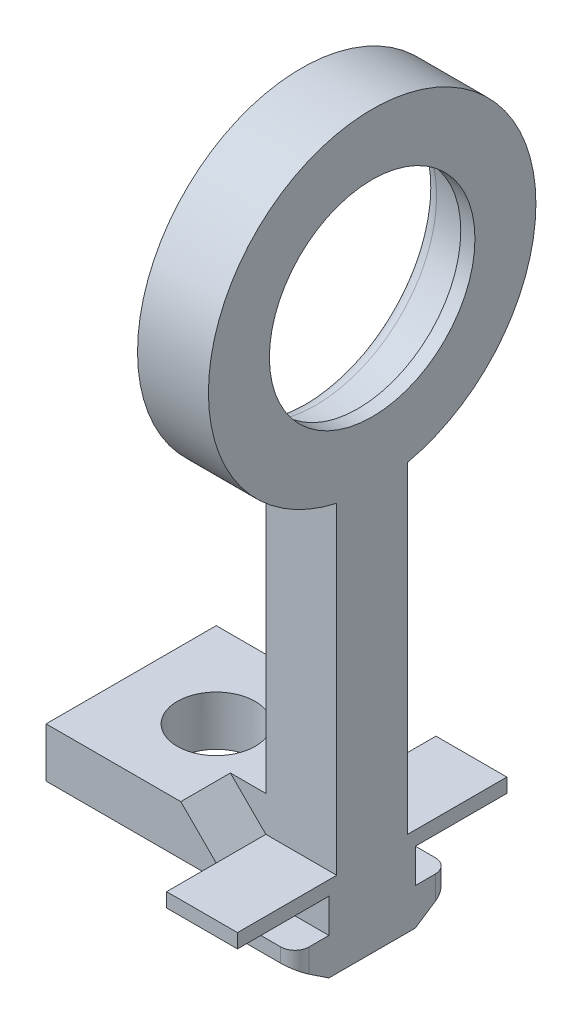
from build123d import *

# Parameters (mm, degrees)
SKETCH1_R            = 11.55
SKETCH1_R_2          = 8.55
BOSS_EXTRUDE1_DEPTH  = 5
SKETCH2_W            = 5
SKETCH2_H            = 23.723808267
BOSS_EXTRUDE2_DEPTH  = 5
BOSS_EXTRUDE3_DEPTH  = 5
FILLET1_R            = 1
SKETCH38_W           = 12
SKETCH38_H           = 3.5
BOSS_EXTRUDE28_DEPTH = 12
CUT_EXTRUDE3_REACH   = 49.704
SKETCH39_R           = 2.75
CHAMFER1_SIZE        = 2.5
FILLET3_R            = 1
SKETCH1_3_R          = 8.55
SKETCH1_3_R_2        = 7.25
BOSS_EXTRUDE29_DEPTH = 1


with BuildPart() as part:
    # Sketch1 → Boss-Extrude1 (new body)
    with BuildSketch(Plane(origin=(0, 0, 0), x_dir=(0, 0, -1), z_dir=(1, 0, 0))):
        Circle(SKETCH1_R)
        Circle(SKETCH1_R_2, mode=Mode.SUBTRACT)
    extrude(amount=-BOSS_EXTRUDE1_DEPTH)

    # Sketch2 → Boss-Extrude2 (add)
    with BuildSketch(Plane(origin=(0, 0, 0), x_dir=(0, 0, -1), z_dir=(1, 0, 0))):
        with Locations((0, -23.138095867)):
            Rectangle(SKETCH2_W, SKETCH2_H)
    extrude(amount=-BOSS_EXTRUDE2_DEPTH)

    # Sketch3 → Boss-Extrude3 (add)
    with BuildSketch(Plane(origin=(0, 0, 0), x_dir=(0, 0, -1), z_dir=(1, 0, 0))):
        Polygon((-9.5, -35), (-9.5, -34), (9.5, -34), (9.5, -35), (3.05, -35), (3.05, -37.4), (5.45, -37.4), (5.45, -38.4), (3.05, -40), (-3.05, -40), (-5.45, -38.4), (-5.45, -37.4), (-3.05, -37.4), (-3.05, -35), align=None)
    extrude(amount=-BOSS_EXTRUDE3_DEPTH)

    # Fillet1
    fillet1_edges = [part.edges().sort_by_distance(p)[0] for p in [
        (0, -37.9, 5.45),
        (0, -37.9, -5.45),
    ]]
    fillet(fillet1_edges, radius=FILLET1_R)

    # Sketch38 → Boss-Extrude28 (add)
    with BuildSketch(Plane.ZY.offset(5)):
        with Locations((0, -33.25)):
            Rectangle(SKETCH38_W, SKETCH38_H)
    extrude(amount=BOSS_EXTRUDE28_DEPTH)

    # Sketch39 → Cut-Extrude3 (cut, up to next)
    with BuildSketch(Plane(origin=(0, -31.5, 0), x_dir=(1, 0, 0), z_dir=(0, 1, 0)), mode=Mode.PRIVATE) as cut_extrude3_sk1:
        with Locations(Location((-11, 0, 0), (0, 0, 270))):
            Circle(SKETCH39_R)
    cut_extrude3_tool1 = extrude(cut_extrude3_sk1.sketch, amount=-CUT_EXTRUDE3_REACH, mode=Mode.PRIVATE) & part.part
    add(cut_extrude3_tool1.solids().sort_by_distance((-11, -31.5, 0))[0], mode=Mode.SUBTRACT)

    # Chamfer1
    chamfer1_edges = [part.edges().sort_by_distance(p)[0] for p in [
        (-5, -31.5, 4.25),
        (-5, -31.5, -4.25),
    ]]
    chamfer(chamfer1_edges, length=CHAMFER1_SIZE - 0.0001)  # a hair under: the kernel refuses the full size

    # Fillet3
    fillet3_edges = [part.edges().sort_by_distance(p)[0] for p in [
        (-5, 0, 8.55),
    ]]
    fillet(fillet3_edges, radius=FILLET3_R)

    # Sketch1<3> → Boss-Extrude29 (add)
    with BuildSketch(Plane(origin=(0, 0, 0), x_dir=(0, 0, -1), z_dir=(1, 0, 0))):
        Circle(SKETCH1_3_R)
        Circle(SKETCH1_3_R_2, mode=Mode.SUBTRACT)
    extrude(amount=-BOSS_EXTRUDE29_DEPTH)


solid = part.part
